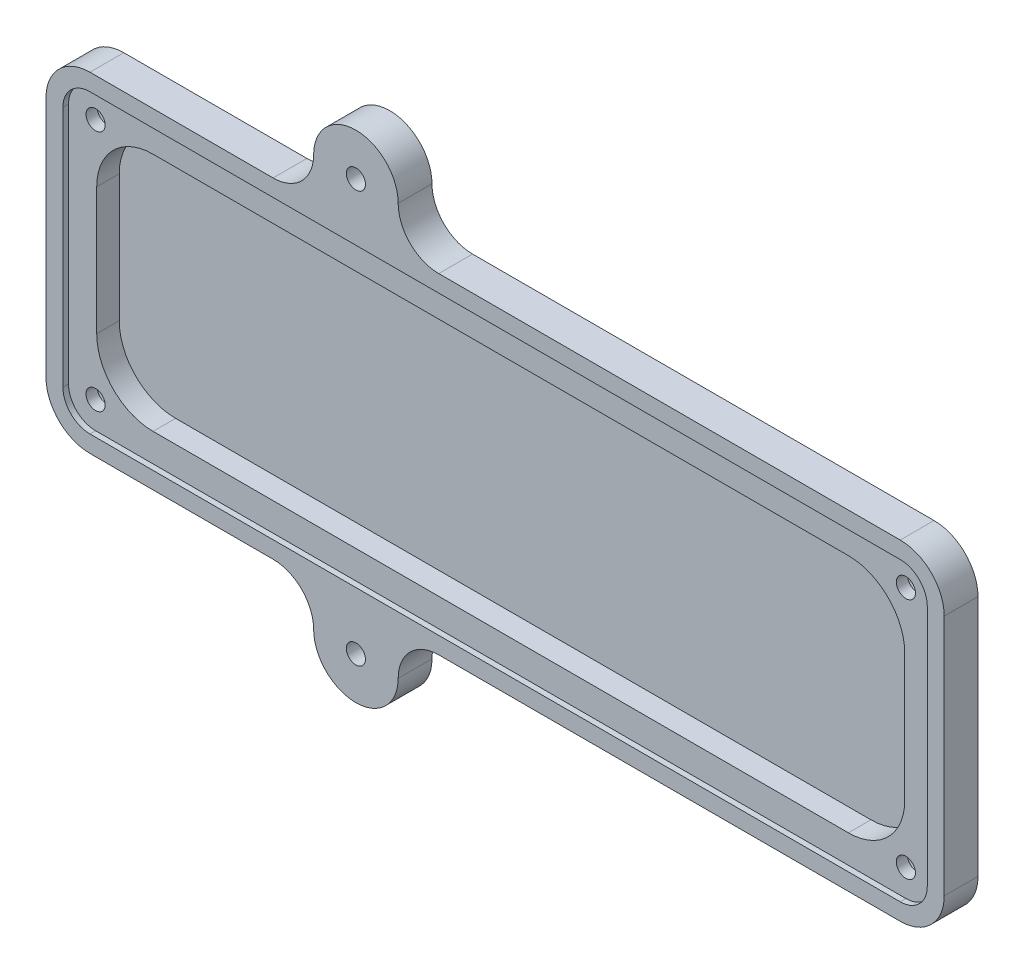
from build123d import *

# Parameters (mm, degrees)
BOSS_EXTRUDE1_DEPTH           = 1
BOSS_EXTRUDE2_START           = 4
BOSS_EXTRUDE2_DEPTH           = 4
BOSS_EXTRUDE3_START           = 1
BOSS_EXTRUDE3_DEPTH           = 1
CBORE_FOR_M3_SHCS1_AT_2_COUNT = 2
CBORE_FOR_M3_SHCS1_AT_2_PITCH = 143.8
CBORE_FOR_M3_SHCS1_AT_3_COUNT = 2
CBORE_FOR_M3_SHCS1_AT_3_PITCH = 150.091438796
CBORE_FOR_M3_SHCS1_AT_4_COUNT = 2
CBORE_FOR_M3_SHCS1_AT_4_PITCH = 43
BOSS_EXTRUDE4_START           = -6
BOSS_EXTRUDE4_OUTLINE_R       = 1.7
BOSS_EXTRUDE4_DEPTH           = 6
BOSS_EXTRUDE5_DEPTH           = 20


# Read off the part's stored shape, not the designer's step: Boss-Extrude4
with BuildPart() as part:
    # Sketch1 → Boss-Extrude1 (new body)
    with BuildSketch(Plane(origin=(0, 0, 1268.319699828), x_dir=(-1, 0, 0), z_dir=(0, 0, -1))):
        with BuildLine():
            Line((-565.344205178, 854.342421724), (-565.344205178, 897.342374326))
            ThreePointArc((-565.344205178, 897.342374326), (-567.628754858, 902.85784955), (-573.144231788, 905.142395114))
            Line((-573.144231788, 905.142395114), (-716.944184389, 905.142395114))
            ThreePointArc((-716.944184389, 905.142395114), (-722.459659614, 902.857845434), (-724.744205178, 897.342368505))
            Line((-724.744205178, 897.342368505), (-724.744205178, 854.342415903))
            ThreePointArc((-724.744205178, 854.342415903), (-722.459655498, 848.826940679), (-716.944178568, 846.542395115))
            Line((-716.944178568, 846.542395115), (-573.144231788, 846.542395115))
            ThreePointArc((-573.144231788, 846.542395115), (-567.6287528, 848.826942737), (-565.344205178, 854.342421724))
        make_face()
        with BuildLine():
            Line((-568.344205178, 854.342399549), (-568.344205178, 897.342395114))
            ThreePointArc((-568.344205178, 897.342395114), (-569.750074712, 900.736528717), (-573.144209613, 902.142395114))
            Line((-573.144209613, 902.142395114), (-716.944205178, 902.142395114))
            ThreePointArc((-716.944205178, 902.142395114), (-720.33833878, 900.736525581), (-721.744205178, 897.342390679))
            Line((-721.744205178, 897.342390679), (-721.744205178, 854.342395114))
            ThreePointArc((-721.744205178, 854.342395114), (-720.338335644, 850.948261512), (-716.944200743, 849.542395115))
            Line((-716.944200743, 849.542395115), (-573.144209613, 849.542395115))
            ThreePointArc((-573.144209613, 849.542395115), (-569.750073144, 850.94826308), (-568.344205178, 854.342399549))
        make_face(mode=Mode.SUBTRACT)
    extrude(amount=-BOSS_EXTRUDE1_DEPTH)

    # Sketch2 → Boss-Extrude2 (add)
    with BuildSketch(Plane(origin=(0, 0, 1268.319699828), x_dir=(-1, 0, 0), z_dir=(0, 0, -1)).offset(BOSS_EXTRUDE2_START)):
        with BuildLine():
            Line((-565.344205178, 854.342421724), (-565.344205178, 897.342374326))
            ThreePointArc((-565.344205178, 897.342374326), (-567.628754858, 902.85784955), (-573.144231788, 905.142395114))
            Line((-573.144231788, 905.142395114), (-716.944184389, 905.142395114))
            ThreePointArc((-716.944184389, 905.142395114), (-722.459659614, 902.857845434), (-724.744205178, 897.342368505))
            Line((-724.744205178, 897.342368505), (-724.744205178, 854.342415903))
            ThreePointArc((-724.744205178, 854.342415903), (-722.459655498, 848.826940679), (-716.944178568, 846.542395115))
            Line((-716.944178568, 846.542395115), (-573.144231788, 846.542395115))
            ThreePointArc((-573.144231788, 846.542395115), (-567.6287528, 848.826942737), (-565.344205178, 854.342421724))
        make_face()
        with BuildLine():
            Line((-573.344205178, 864.542395115), (-573.344205178, 887.142395114))
            ThreePointArc((-573.344205178, 887.142395114), (-576.273137366, 894.213462926), (-583.344205178, 897.142395114))
            Line((-583.344205178, 897.142395114), (-706.744205178, 897.142395114))
            ThreePointArc((-706.744205178, 897.142395114), (-713.81527299, 894.213462926), (-716.744205178, 887.142395114))
            Line((-716.744205178, 887.142395114), (-716.744205178, 864.542395115))
            ThreePointArc((-716.744205178, 864.542395115), (-713.81527299, 857.471327303), (-706.744205178, 854.542395115))
            Line((-706.744205178, 854.542395115), (-583.344205178, 854.542395115))
            ThreePointArc((-583.344205178, 854.542395115), (-576.273137366, 857.471327303), (-573.344205178, 864.542395115))
        make_face(mode=Mode.SUBTRACT)
    extrude(amount=-BOSS_EXTRUDE2_DEPTH)

    # Sketch3 → Boss-Extrude3 (add)
    with BuildSketch(Plane(origin=(0, 0, 1264.319699828), x_dir=(-1, 0, 0), z_dir=(0, 0, -1)).offset(BOSS_EXTRUDE3_START)):
        with BuildLine():
            Line((-565.344205178, 854.342421724), (-565.344205178, 897.342374326))
            ThreePointArc((-565.344205178, 897.342374326), (-567.628754858, 902.85784955), (-573.144231788, 905.142395114))
            Line((-573.144231788, 905.142395114), (-716.944184389, 905.142395114))
            ThreePointArc((-716.944184389, 905.142395114), (-722.459659614, 902.857845434), (-724.744205178, 897.342368505))
            Line((-724.744205178, 897.342368505), (-724.744205178, 854.342415903))
            ThreePointArc((-724.744205178, 854.342415903), (-722.459655498, 848.826940679), (-716.944178568, 846.542395115))
            Line((-716.944178568, 846.542395115), (-573.144231788, 846.542395115))
            ThreePointArc((-573.144231788, 846.542395115), (-567.6287528, 848.826942737), (-565.344205178, 854.342421724))
        make_face()
    extrude(amount=-BOSS_EXTRUDE3_DEPTH)

    # Sketch5 → CBORE for M3 SHCS1 (revolve, cut)
    with BuildSketch(Plane(origin=(716.944205178, 897.342395114, 1263.319699828), x_dir=(0, 1, 0), z_dir=(1, 0, 0))):
        Polygon((0, 0), (0, 6), (1.7, 6), (1.7, 3), (3.25, 3), (3.25, 0.025), (3.275, 0), align=None)
    cbore_for_m3_shcs1 = revolve(axis=Axis((716.944205178, 897.342395114, 1256.969699828), (0, 0, 1)), mode=Mode.SUBTRACT)

    # CBORE for M3 SHCS1 at 2: CBORE for M3 SHCS1 ×2
    with Locations(*[(-i * CBORE_FOR_M3_SHCS1_AT_2_PITCH, 0, 0) for i in range(1, CBORE_FOR_M3_SHCS1_AT_2_COUNT)]):
        add(cbore_for_m3_shcs1, mode=Mode.SUBTRACT)

    # CBORE for M3 SHCS1 at 3: CBORE for M3 SHCS1 ×2
    with Locations(*[Vector(-0.958082627184226, -0.2864920234278285, 0) * (i * CBORE_FOR_M3_SHCS1_AT_3_PITCH) for i in range(1, CBORE_FOR_M3_SHCS1_AT_3_COUNT)]):
        add(cbore_for_m3_shcs1, mode=Mode.SUBTRACT)

    # CBORE for M3 SHCS1 at 4: CBORE for M3 SHCS1 ×2
    with Locations(*[(0, -i * CBORE_FOR_M3_SHCS1_AT_4_PITCH, 0) for i in range(1, CBORE_FOR_M3_SHCS1_AT_4_COUNT)]):
        add(cbore_for_m3_shcs1, mode=Mode.SUBTRACT)


with BuildPart() as boss_extrude4_tool:
    # Boss-Extrude4 outline → Boss-Extrude4 (new body)
    # profile 1 of 2: a face of its own
    with BuildSketch(Plane(origin=(0, 0, 1263.319699828), x_dir=(-1, 0, 0), z_dir=(0, 0, -1)).offset(BOSS_EXTRUDE4_START)):
        with BuildLine():
            ThreePointArc((-635.044202268, 846.542389294), (-629.953035501, 844.433558971), (-627.844205178, 839.342392204))
            ThreePointArc((-627.844205178, 839.342392204), (-620.344205178, 831.842392204), (-612.844205178, 839.342392204))
            ThreePointArc((-612.844205178, 839.342392204), (-610.735374855, 844.433558971), (-605.644208088, 846.542389294))
            Line((-605.644208088, 846.542389294), (-635.044202268, 846.542389294))
        make_face()
        with Locations((-620.344205178, 839.342392204)):
            Circle(BOSS_EXTRUDE4_OUTLINE_R, mode=Mode.SUBTRACT)
    # profile 2 of 2: a face of its own
    with BuildSketch(Plane(origin=(0, 0, 1263.319699828), x_dir=(-1, 0, 0), z_dir=(0, 0, -1)).offset(BOSS_EXTRUDE4_START)):
        with BuildLine():
            ThreePointArc((-605.644208088, 905.142395114), (-610.735374855, 907.251225437), (-612.844205178, 912.342392204))
            ThreePointArc((-612.844205178, 912.342392204), (-620.344205178, 919.842392204), (-627.844205178, 912.342392204))
            ThreePointArc((-627.844205178, 912.342392204), (-629.953035501, 907.251225437), (-635.044202268, 905.142395114))
            Line((-635.044202268, 905.142395114), (-605.644208088, 905.142395114))
        make_face()
        with Locations((-620.344205178, 912.342392204)):
            Circle(BOSS_EXTRUDE4_OUTLINE_R, mode=Mode.SUBTRACT)
    extrude(amount=BOSS_EXTRUDE4_DEPTH)


with BuildPart() as part_1:
    add(part.part)


with BuildPart() as part_2:
    # Boss-Extrude4: joined with boss_extrude4_tool
    add(part_1.part.fuse(boss_extrude4_tool.part, tol=0.00001))

    # Sketch7 → Boss-Extrude5 (add)
    with BuildSketch(Plane(origin=(655.044202268, 0, 0), x_dir=(0, 0, -1), z_dir=(1, 0, 0))):
        with BuildLine():
            Line((-1263.319699828, 849.042392204), (-1256.519699828, 849.042392204))
            Line((-1256.519699828, 849.042392204), (-1256.519699828, 846.042392204))
            Line((-1256.519699828, 846.042392204), (-1253.519699828, 846.042392204))
            Line((-1253.519699828, 846.042392204), (-1253.519699828, 854.042392204))
            Line((-1253.519699828, 854.042392204), (-1258.319699828, 854.042392204))
            ThreePointArc((-1258.319699828, 854.042392204), (-1261.855233734, 855.506858298), (-1263.319699828, 859.042392204))
            Line((-1263.319699828, 859.042392204), (-1263.319699828, 849.042392204))
        make_face()
    extrude(amount=BOSS_EXTRUDE5_DEPTH)


solid = part_2.part
